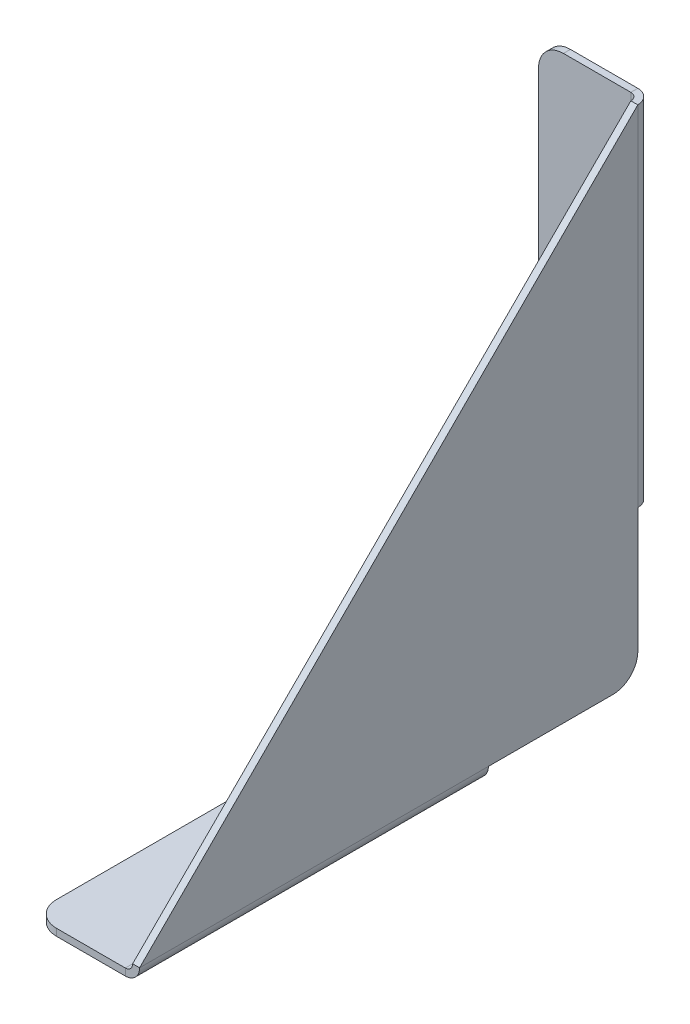
from build123d import *

# Parameters (mm, degrees)
BASE_FLANGE1_DEPTH    = 0.7
EDGE_FLANGE1_DEPTH    = 35
EDGE_FLANGE2_DEPTH    = 35
BREAK_CORNER1_START   = -1.4366
BREAK_CORNER1_DEPTH   = 0.7
BREAK_CORNER1_START_2 = -0.7
BREAK_CORNER1_2_DEPTH = 0.7
BREAK_CORNER1_START_3 = -51.4366
BREAK_CORNER1_3_DEPTH = 0.7


# Read off the part's stored shape, not the designer's step: Break-Corner1
# Sheet-metal steps are written as plain solids
with BuildPart() as part:
    # Sketch1 → Base-Flange1 (new body)
    with BuildSketch(Plane(origin=(0, 0, 0), x_dir=(0, 0, -1), z_dir=(1, 0, 0))):
        Polygon((0, 0), (50, 50), (50, 0), align=None)
    extrude(amount=-BASE_FLANGE1_DEPTH)

    # Edge-Flange1 section (across the edge) → Edge-Flange1 (add)
    with BuildSketch(Plane(origin=(-0.7, 50, -50.7366), x_dir=(0, 0, 1), z_dir=(0, -1, 0))):
        with BuildLine():
            Line((-0.7, 0.7366), (-0.7, 10))
            Line((-0.7, 10), (0, 10))
            Line((0, 10), (0, 0.7366))
            ThreePointArc((0, 0.7366), (0.215745145, 0.215745145), (0.7366, 0))
            Line((0.7366, 0), (0.7366, -0.7))
            ThreePointArc((0.7366, -0.7), (-0.279229602, -0.279229602), (-0.7, 0.7366))
        make_face()
    extrude(amount=EDGE_FLANGE1_DEPTH)

    # Edge-Flange2 section (across the edge) → Edge-Flange2 (add)
    with BuildSketch(Plane(origin=(-0.7, -0.7366, -35), x_dir=(0, 1, 0), z_dir=(0, 0, 1))):
        with BuildLine():
            Line((-0.7, 0.7366), (-0.7, 10.1366))
            Line((-0.7, 10.1366), (0, 10.1366))
            Line((0, 10.1366), (0, 0.7366))
            ThreePointArc((0, 0.7366), (0.215745145, 0.215745145), (0.7366, 0))
            Line((0.7366, 0), (0.7366, -0.7))
            ThreePointArc((0.7366, -0.7), (-0.279229602, -0.279229602), (-0.7, 0.7366))
        make_face()
    extrude(amount=EDGE_FLANGE2_DEPTH)

    # Break-Corner1 outline → Break-Corner1 (cut)
    with BuildSketch(Plane(origin=(0, 0, 0), x_dir=(1, 0, 0), z_dir=(0, 1, 0)).offset(BREAK_CORNER1_START)):
        with BuildLine():
            ThreePointArc((-8.3366, 0), (-10.104366953, 0.732233047), (-10.8366, 2.5))
            Line((-10.8366, 2.5), (-10.8366, 0))
            Line((-10.8366, 0), (-8.3366, 0))
        make_face()
        with BuildLine():
            ThreePointArc((-10.8366, 32.5), (-10.104366953, 34.267766953), (-8.3366, 35))
            Line((-8.3366, 35), (-10.8366, 35))
            Line((-10.8366, 35), (-10.8366, 32.5))
        make_face()
    extrude(amount=BREAK_CORNER1_DEPTH, mode=Mode.SUBTRACT)

    # Break-Corner1 2 outline → Break-Corner1 2 (cut)
    with BuildSketch(Plane.YZ.offset(BREAK_CORNER1_START_2)):
        with BuildLine():
            ThreePointArc((2.5, -50), (0.732233047, -49.267766953), (0, -47.5))
            Line((0, -47.5), (0, -50))
            Line((0, -50), (2.5, -50))
        make_face()
    extrude(amount=BREAK_CORNER1_2_DEPTH, mode=Mode.SUBTRACT)

    # Break-Corner1 3 outline → Break-Corner1 3 (cut)
    with BuildSketch(Plane.XY.offset(BREAK_CORNER1_START_3)):
        with BuildLine():
            Line((-10.7, 50), (-10.7, 47.5))
            ThreePointArc((-10.7, 47.5), (-9.967766953, 49.267766953), (-8.2, 50))
            Line((-8.2, 50), (-10.7, 50))
        make_face()
        with BuildLine():
            ThreePointArc((-8.2, 15), (-9.967766953, 15.732233047), (-10.7, 17.5))
            Line((-10.7, 17.5), (-10.7, 15))
            Line((-10.7, 15), (-8.2, 15))
        make_face()
    extrude(amount=BREAK_CORNER1_3_DEPTH, mode=Mode.SUBTRACT)


solid = part.part
